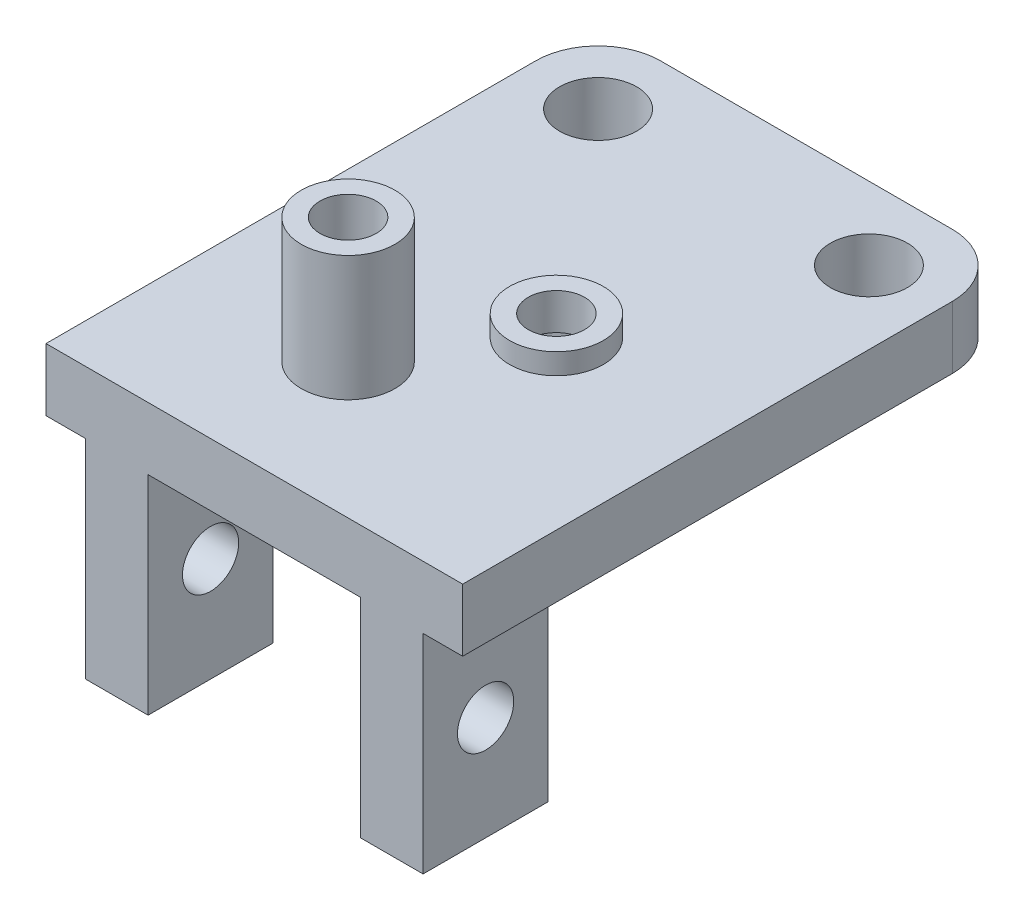
from build123d import *

# Parameters (mm, degrees)
SKETCH1_W             = 40
SKETCH1_H             = 53
BOSS_EXTRUDE1_DEPTH   = 6
SKETCH16_R            = 4.5
BOSS_EXTRUDE3_DEPTH   = 2
SKETCH16_3_R          = 4.5
BOSS_EXTRUDE4_DEPTH   = 12
CUT_EXTRUDE1_DEPTH    = 4.5
F_5_4MM_DOWEL_HOLE1_D = 5.4
F_7_4MM_DOWEL_HOLE2_D = 7.4
SKETCH2_W             = 6
SKETCH2_H             = 12
BOSS_EXTRUDE2_DEPTH   = 20
F_5_4MM_DOWEL_HOLE3_D = 5.4
FILLET1_R             = 6
MIRROR2_OUTLINE_R     = 3.7
MIRROR2_DEPTH         = 6
MIRROR2_START         = 4.5
MIRROR2_2_OUTLINE_R   = 4.5
MIRROR2_2_OUTLINE_R_2 = 2.7
MIRROR2_2_DEPTH       = 13.5
MIRROR2_3_OUTLINE_R   = 4.5
MIRROR2_3_OUTLINE_R_2 = 2.7
MIRROR2_3_DEPTH       = 3.5
MIRROR2_4_DEPTH       = 1.5
MIRROR2_START_2       = -36.2
MIRROR2_5_OUTLINE_W   = 20
MIRROR2_5_OUTLINE_H   = 12
MIRROR2_5_OUTLINE_R   = 2.7
MIRROR2_5_DEPTH       = 6
MIRROR2_START_3       = -9.8
MIRROR2_6_OUTLINE_W   = 20
MIRROR2_6_OUTLINE_H   = 12
MIRROR2_6_OUTLINE_R   = 2.7
MIRROR2_6_DEPTH       = 6


# Read off the part's stored shape, not the designer's step: Mirror2
with BuildPart() as part:
    # Sketch1 → Boss-Extrude1 (new body)
    with BuildSketch(Plane(origin=(0, 0, 0), x_dir=(1, 0, 0), z_dir=(0, 1, 0))):
        with Locations((20, 26.5)):
            Rectangle(SKETCH1_W, SKETCH1_H)
    extrude(amount=BOSS_EXTRUDE1_DEPTH)

    # Sketch16 → Boss-Extrude3 (add)
    with BuildSketch(Plane(origin=(0, 6, 0), x_dir=(1, 0, 0), z_dir=(0, 1, 0))):
        with Locations(Location((16, 25, 0), (0, 0, 90))):
            Circle(SKETCH16_R)
    extrude(amount=BOSS_EXTRUDE3_DEPTH)

    # Sketch16<3> → Boss-Extrude4 (add)
    with BuildSketch(Plane(origin=(0, 6, 0), x_dir=(1, 0, 0), z_dir=(0, 1, 0))):
        with Locations(Location((24, 13, 0), (0, 0, 90))):
            Circle(SKETCH16_3_R)
    extrude(amount=BOSS_EXTRUDE4_DEPTH)

    # Sketch12 → Cut-Extrude1 (cut)
    with BuildSketch(Plane.XZ):
        Polygon((28.2, -10.575128869), (24, -8.150257739), (19.8, -10.575128869), (19.8, -15.424871131), (24, -17.849742261), (28.2, -15.424871131), align=None)
        Polygon((16, -20.150257739), (11.8, -22.575128869), (11.8, -27.424871131), (16, -29.849742261), (20.2, -27.424871131), (20.2, -22.575128869), align=None)
    extrude(amount=-CUT_EXTRUDE1_DEPTH, mode=Mode.SUBTRACT)

    # Ø5.4mm Dowel Hole1 (through all)
    with Locations(Plane(origin=(0, 0, 0), x_dir=(-1, 0, 0), z_dir=(0, -1, 0))):
        with Locations((-16, 25), (-24, 13)):
            Hole(F_5_4MM_DOWEL_HOLE1_D / 2)

    # Ø7.4mm Dowel Hole2 (through all)
    with Locations(Plane(origin=(0, 6, 0), x_dir=(1, 0, 0), z_dir=(0, 1, 0))):
        with Locations((7, 46)):
            f_7_4mm_dowel_hole2 = Hole(F_7_4MM_DOWEL_HOLE2_D / 2)

    # Sketch2 → Boss-Extrude2 (add)
    with BuildSketch(Plane.XZ):
        with Locations((6.8, -6)):
            Rectangle(SKETCH2_W, SKETCH2_H)
    boss_extrude2 = extrude(amount=BOSS_EXTRUDE2_DEPTH)

    # Ø5.4mm Dowel Hole3 (through all)
    with Locations(Plane(origin=(9.8, 0, 0), x_dir=(0, 0, -1), z_dir=(1, 0, 0))):
        with Locations((6, -10)):
            f_5_4mm_dowel_hole3 = Hole(F_5_4MM_DOWEL_HOLE3_D / 2)

    # Mirror1: Ø7.4mm Dowel Hole2, Boss-Extrude2, Ø5.4mm Dowel Hole3 across plane
    add(f_7_4mm_dowel_hole2.mirror(Plane(origin=(20, 0, 0), x_dir=(0, 0, 1), z_dir=(1, 0, 0))), mode=Mode.SUBTRACT)
    add(boss_extrude2.mirror(Plane(origin=(20, 0, 0), x_dir=(0, 0, 1), z_dir=(1, 0, 0))))
    add(f_5_4mm_dowel_hole3.mirror(Plane(origin=(20, 0, 0), x_dir=(0, 0, 1), z_dir=(1, 0, 0))), mode=Mode.SUBTRACT)

    # Fillet1
    fillet1_edges = [part.edges().sort_by_distance(p)[0] for p in [
        (0, 3, -53),
        (40, 3, -53),
    ]]
    fillet(fillet1_edges, radius=FILLET1_R)

    # Mirror2 outline → Mirror2 (add)
    with BuildSketch(Plane(origin=(0, 0, 0), x_dir=(1, 0, 0), z_dir=(0, 1, 0))):
        with BuildLine():
            Line((-6, 53), (-34, 53))
            ThreePointArc((-34, 53), (-38.242640687, 51.242640687), (-40, 47))
            Line((-40, 47), (-40, 0))
            Line((-40, 0), (0, 0))
            Line((0, 0), (0, 47))
            ThreePointArc((0, 47), (-1.757359313, 51.242640687), (-6, 53))
        make_face()
        Polygon((-19.8, 10.575128869), (-24, 8.150257739), (-28.2, 10.575128869), (-28.2, 15.424871131), (-24, 17.849742261), (-19.8, 15.424871131), align=None, mode=Mode.SUBTRACT)
        with Locations((-33, 46)):
            Circle(MIRROR2_OUTLINE_R, mode=Mode.SUBTRACT)
        with Locations((-7, 46)):
            Circle(MIRROR2_OUTLINE_R, mode=Mode.SUBTRACT)
        Polygon((-11.8, 27.424871131), (-11.8, 22.575128869), (-16, 20.150257739), (-20.2, 22.575128869), (-20.2, 27.424871131), (-16, 29.849742261), align=None, mode=Mode.SUBTRACT)
    extrude(amount=MIRROR2_DEPTH)

    # Mirror2 2 outline → Mirror2 2 (add)
    with BuildSketch(Plane(origin=(0, 0, 0), x_dir=(1, 0, 0), z_dir=(0, 1, 0)).offset(MIRROR2_START)):
        with Locations((-24, 13)):
            Circle(MIRROR2_2_OUTLINE_R)
        with Locations((-24, 13)):
            Circle(MIRROR2_2_OUTLINE_R_2, mode=Mode.SUBTRACT)
    extrude(amount=MIRROR2_2_DEPTH)

    # Mirror2 3 outline → Mirror2 3 (add)
    with BuildSketch(Plane(origin=(0, 0, 0), x_dir=(1, 0, 0), z_dir=(0, 1, 0)).offset(MIRROR2_START)):
        with Locations((-16, 25)):
            Circle(MIRROR2_3_OUTLINE_R)
        with Locations((-16, 25)):
            Circle(MIRROR2_3_OUTLINE_R_2, mode=Mode.SUBTRACT)
    extrude(amount=MIRROR2_3_DEPTH)

    # Mirror2 4 outline → Mirror2 4 (add)
    with BuildSketch(Plane(origin=(0, 0, 0), x_dir=(1, 0, 0), z_dir=(0, 1, 0)).offset(MIRROR2_START)):
        with BuildLine():
            ThreePointArc((-20.500893142, 15.829531975), (-20.102885683, 15.25), (-19.8, 14.615549442))
            Line((-19.8, 14.615549442), (-19.8, 15.424871131))
            Line((-19.8, 15.424871131), (-20.500893142, 15.829531975))
        make_face()
        with BuildLine():
            Line((-19.8, 10.575128869), (-19.8, 11.384450558))
            ThreePointArc((-19.8, 11.384450558), (-20.102885683, 10.75), (-20.500893142, 10.170468025))
            Line((-20.500893142, 10.170468025), (-19.8, 10.575128869))
        make_face()
        with BuildLine():
            ThreePointArc((-24.700893142, 17.445081417), (-24, 17.5), (-23.299106858, 17.445081417))
            Line((-23.299106858, 17.445081417), (-24, 17.849742261))
            Line((-24, 17.849742261), (-24.700893142, 17.445081417))
        make_face()
        with BuildLine():
            Line((-24, 8.150257739), (-23.299106858, 8.554918583))
            ThreePointArc((-23.299106858, 8.554918583), (-24, 8.5), (-24.700893142, 8.554918583))
            Line((-24.700893142, 8.554918583), (-24, 8.150257739))
        make_face()
        with BuildLine():
            ThreePointArc((-28.2, 14.615549442), (-27.897114317, 15.25), (-27.499106858, 15.829531975))
            Line((-27.499106858, 15.829531975), (-28.2, 15.424871131))
            Line((-28.2, 15.424871131), (-28.2, 14.615549442))
        make_face()
        with BuildLine():
            Line((-28.2, 10.575128869), (-27.499106858, 10.170468025))
            ThreePointArc((-27.499106858, 10.170468025), (-27.897114317, 10.75), (-28.2, 11.384450558))
            Line((-28.2, 11.384450558), (-28.2, 10.575128869))
        make_face()
        with BuildLine():
            ThreePointArc((-12.500893142, 27.829531975), (-12.102885683, 27.25), (-11.8, 26.615549442))
            Line((-11.8, 26.615549442), (-11.8, 27.424871131))
            Line((-11.8, 27.424871131), (-12.500893142, 27.829531975))
        make_face()
        with BuildLine():
            Line((-11.8, 22.575128869), (-11.8, 23.384450558))
            ThreePointArc((-11.8, 23.384450558), (-12.102885683, 22.75), (-12.500893142, 22.170468025))
            Line((-12.500893142, 22.170468025), (-11.8, 22.575128869))
        make_face()
        with BuildLine():
            ThreePointArc((-16.700893142, 29.445081417), (-16, 29.5), (-15.299106858, 29.445081417))
            Line((-15.299106858, 29.445081417), (-16, 29.849742261))
            Line((-16, 29.849742261), (-16.700893142, 29.445081417))
        make_face()
        with BuildLine():
            Line((-16, 20.150257739), (-15.299106858, 20.554918583))
            ThreePointArc((-15.299106858, 20.554918583), (-16, 20.5), (-16.700893142, 20.554918583))
            Line((-16.700893142, 20.554918583), (-16, 20.150257739))
        make_face()
        with BuildLine():
            ThreePointArc((-20.2, 26.615549442), (-19.897114317, 27.25), (-19.499106858, 27.829531975))
            Line((-19.499106858, 27.829531975), (-20.2, 27.424871131))
            Line((-20.2, 27.424871131), (-20.2, 26.615549442))
        make_face()
        with BuildLine():
            Line((-20.2, 22.575128869), (-19.499106858, 22.170468025))
            ThreePointArc((-19.499106858, 22.170468025), (-19.897114317, 22.75), (-20.2, 23.384450558))
            Line((-20.2, 23.384450558), (-20.2, 22.575128869))
        make_face()
    extrude(amount=MIRROR2_4_DEPTH)

    # Mirror2 5 outline → Mirror2 5 (add)
    with BuildSketch(Plane.YZ.offset(MIRROR2_START_2)):
        with Locations((-10, -6)):
            Rectangle(MIRROR2_5_OUTLINE_W, MIRROR2_5_OUTLINE_H)
        with Locations((-10, -6)):
            Circle(MIRROR2_5_OUTLINE_R, mode=Mode.SUBTRACT)
    extrude(amount=MIRROR2_5_DEPTH)

    # Mirror2 6 outline → Mirror2 6 (add)
    with BuildSketch(Plane.YZ.offset(MIRROR2_START_3)):
        with Locations((-10, -6)):
            Rectangle(MIRROR2_6_OUTLINE_W, MIRROR2_6_OUTLINE_H)
        with Locations((-10, -6)):
            Circle(MIRROR2_6_OUTLINE_R, mode=Mode.SUBTRACT)
    extrude(amount=MIRROR2_6_DEPTH)

    # Split1
    split(bisect_by=Plane(origin=(0, 0, 0), x_dir=(0, 0, 1), z_dir=(1, 0, 0)), keep=Keep.BOTTOM)


solid = part.part
